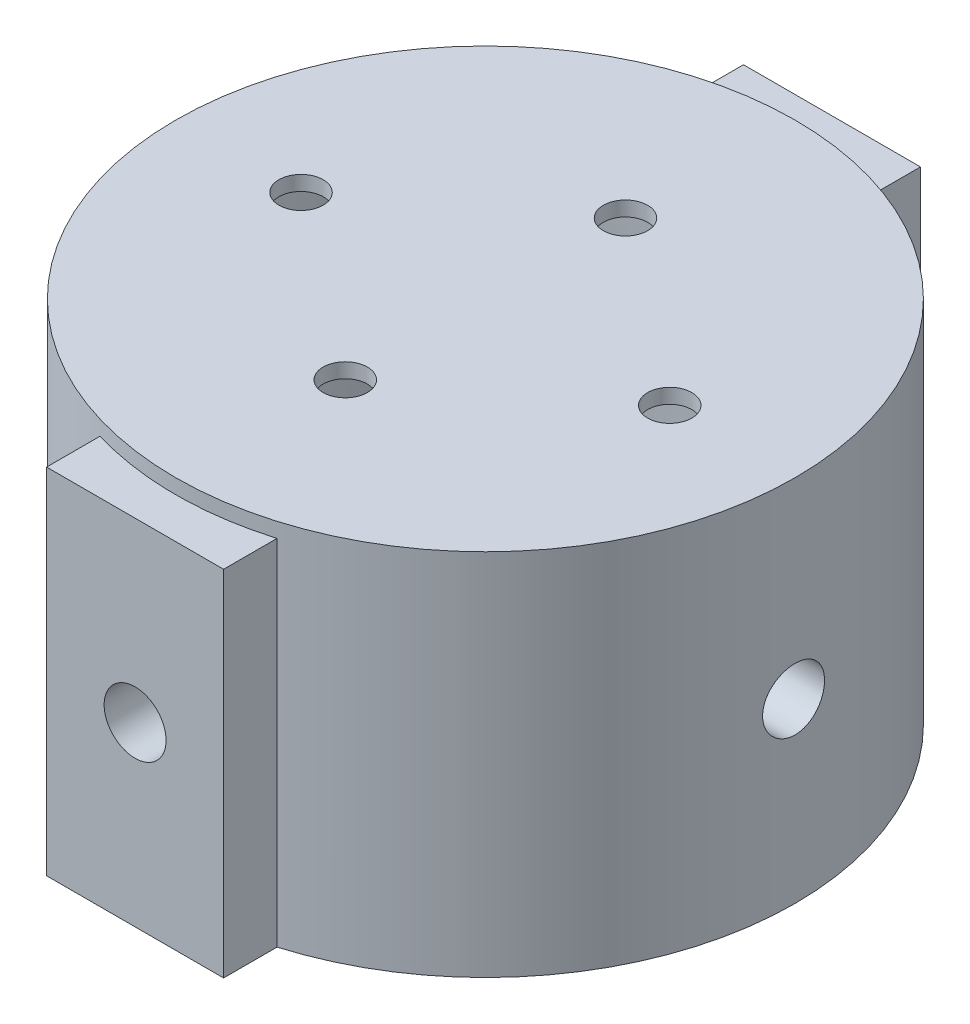
from build123d import *

# Parameters (mm, degrees)
SKETCH1_R               = 21
SKETCH1_R_2             = 17.75
BOSS_EXTRUDE2_DEPTH     = 12
SKETCH5_W               = 12
SKETCH5_H               = 6
BOSS_EXTRUDE7_DEPTH     = 12
SKETCH6_W               = 12
SKETCH6_H               = 6
BOSS_EXTRUDE8_DEPTH     = 12
SKETCH7_R               = 2.1
CUT_EXTRUDE1_DEPTH      = 54.080716838
BOSS_EXTRUDE9_START     = 1
SKETCH8_R               = 21
BOSS_EXTRUDE9_DEPTH     = 1
CUT_EXTRUDE2_REACH      = 42.374
SKETCH9_R               = 1.5
CUT_EXTRUDE3_DEPTH      = 39.236925932
CUT_EXTRUDE3_DEPTH_BACK = 39.236925932
SKETCH10_R              = 2.1


with BuildPart() as part:
    # Sketch1 → Boss-Extrude2 (new, symmetric)
    with BuildSketch(Plane(origin=(0, 0, 0), x_dir=(1, 0, 0), z_dir=(0, 1, 0))):
        Circle(SKETCH1_R)
        Circle(SKETCH1_R_2, mode=Mode.SUBTRACT)
    extrude(amount=BOSS_EXTRUDE2_DEPTH, both=True)

    # Sketch6 → Boss-Extrude8 (add, symmetric)
    with BuildSketch(Plane(origin=(0, 0, 0), x_dir=(1, 0, 0), z_dir=(0, 1, 0))):
        with Locations((0, -20.75)):
            Rectangle(SKETCH6_W, SKETCH6_H)
    extrude(amount=BOSS_EXTRUDE8_DEPTH, both=True)


with BuildPart() as body_2:
    # Sketch5 → Boss-Extrude7 (new, symmetric)
    with BuildSketch(Plane(origin=(0, 0, 0), x_dir=(1, 0, 0), z_dir=(0, 1, 0))):
        with Locations((0, 20.5)):
            Rectangle(SKETCH5_W, SKETCH5_H)
    extrude(amount=BOSS_EXTRUDE7_DEPTH, both=True)


with BuildPart() as cut_extrude1_tool:
    # Sketch7 → Cut-Extrude1 (new, through all)
    with BuildSketch(Plane(origin=(0, 0, -23.5), x_dir=(-1, 0, 0), z_dir=(0, 0, -1))):
        Circle(SKETCH7_R)
    extrude(amount=-CUT_EXTRUDE1_DEPTH)


with BuildPart() as part_1:
    add(part.part)

    # Cut-Extrude1: cut by cut_extrude1_tool
    add(cut_extrude1_tool.part, mode=Mode.SUBTRACT)



with BuildPart() as body_2_1:
    add(body_2.part)

    # Cut-Extrude1: cut by cut_extrude1_tool
    add(cut_extrude1_tool.part, mode=Mode.SUBTRACT)


with BuildPart() as part_2:
    add(part_1.part)

    add(body_2_1.part)  # Boss-Extrude9 merges body 2
    # Sketch8 → Boss-Extrude9 (add)
    with BuildSketch(Plane(origin=(0, 12, 0), x_dir=(1, 0, 0), z_dir=(0, 1, 0)).offset(BOSS_EXTRUDE9_START)):
        Circle(SKETCH8_R)
    extrude(amount=-BOSS_EXTRUDE9_DEPTH)

    # Sketch9 → Cut-Extrude2 (cut, up to next)
    with BuildSketch(Plane(origin=(0, 13, 0), x_dir=(1, 0, 0), z_dir=(0, 1, 0)), mode=Mode.PRIVATE) as cut_extrude2_sk1:
        with Locations((0, 9.5)):
            Circle(SKETCH9_R)
    cut_extrude2_tool1 = extrude(cut_extrude2_sk1.sketch, amount=-CUT_EXTRUDE2_REACH, mode=Mode.PRIVATE) & part_2.part
    # Sketch9 → Cut-Extrude2 (cut, up to next)
    with BuildSketch(Plane(origin=(0, 13, 0), x_dir=(1, 0, 0), z_dir=(0, 1, 0)), mode=Mode.PRIVATE) as cut_extrude2_sk2:
        with Locations((0, -9.5)):
            Circle(SKETCH9_R)
    cut_extrude2_tool2 = extrude(cut_extrude2_sk2.sketch, amount=-CUT_EXTRUDE2_REACH, mode=Mode.PRIVATE) & part_2.part
    # Sketch9 → Cut-Extrude2 (cut, up to next)
    with BuildSketch(Plane(origin=(0, 13, 0), x_dir=(1, 0, 0), z_dir=(0, 1, 0)), mode=Mode.PRIVATE) as cut_extrude2_sk3:
        with Locations((-12.5, 0)):
            Circle(SKETCH9_R)
    cut_extrude2_tool3 = extrude(cut_extrude2_sk3.sketch, amount=-CUT_EXTRUDE2_REACH, mode=Mode.PRIVATE) & part_2.part
    # Sketch9 → Cut-Extrude2 (cut, up to next)
    with BuildSketch(Plane(origin=(0, 13, 0), x_dir=(1, 0, 0), z_dir=(0, 1, 0)), mode=Mode.PRIVATE) as cut_extrude2_sk4:
        with Locations((12.5, 0)):
            Circle(SKETCH9_R)
    cut_extrude2_tool4 = extrude(cut_extrude2_sk4.sketch, amount=-CUT_EXTRUDE2_REACH, mode=Mode.PRIVATE) & part_2.part
    add(cut_extrude2_tool1.solids().sort_by_distance((0, 13, -9.5))[0], mode=Mode.SUBTRACT)
    add(cut_extrude2_tool2.solids().sort_by_distance((0, 13, 9.5))[0], mode=Mode.SUBTRACT)
    add(cut_extrude2_tool3.solids().sort_by_distance((-12.5, 13, 0))[0], mode=Mode.SUBTRACT)
    add(cut_extrude2_tool4.solids().sort_by_distance((12.5, 13, 0))[0], mode=Mode.SUBTRACT)

    # Sketch10 → Cut-Extrude3 (cut, two sides: drawn at the far end of the back side and taken through both)
    with BuildSketch(Plane.ZY.offset(6).offset(-CUT_EXTRUDE3_DEPTH_BACK)):
        Circle(SKETCH10_R)
    extrude(amount=CUT_EXTRUDE3_DEPTH + CUT_EXTRUDE3_DEPTH_BACK, mode=Mode.SUBTRACT)


solid = part_2.part
